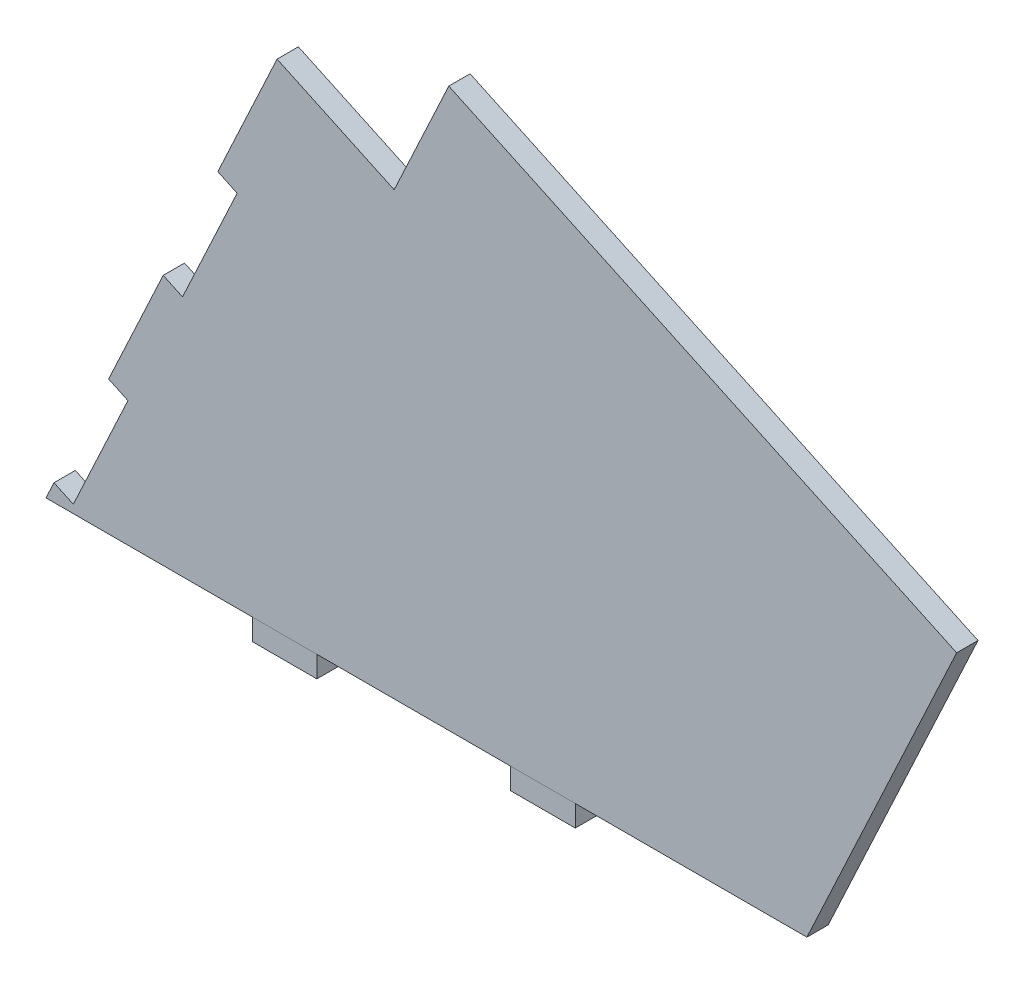
from build123d import *

# Parameters (mm, degrees)
BOSS_EXTRUDE1_DEPTH   = 3.3
CUT_EXTRUDE1_DEPTH    = 3.3
SKETCH3_W             = 10
SKETCH3_H             = 3.3
BOSS_EXTRUDE2_DEPTH   = 3.3
BOSS_EXTRUDE2_2_DEPTH = 3.3


with BuildPart() as part:
    # Sketch1 → Boss-Extrude1 (new body)
    with BuildSketch(Plane.XY.offset(396.7)):
        Polygon((-321.546211223, 12.634626083), (-203.763939035, 12.634626089), (-180.579435925, 62.353953457), (-259.198908878, 99.014815774), (-267.651274112, 80.888660034), (-285.777429853, 89.341025269), align=None)
    extrude(amount=-BOSS_EXTRUDE1_DEPTH)

    # Sketch2 → Cut-Extrude1 (cut)
    with BuildSketch(Plane.XY.offset(396.7)):
        Polygon((-311.856397536, 33.414498593), (-320.308762771, 15.288342852), (-317.317947074, 13.893702588), (-308.865581839, 32.019858329), align=None)
        Polygon((-303.404032301, 51.540654333), (-294.951667066, 69.666810074), (-291.960851369, 68.27216981), (-300.413216604, 50.14601407), align=None)
    extrude(amount=-CUT_EXTRUDE1_DEPTH, mode=Mode.SUBTRACT)


with BuildPart() as body_2:
    # Sketch3 → Boss-Extrude2 (new body)
    with BuildSketch(Plane.XY.offset(396.7)):
        with Locations((-244.617848709, 10.984626083)):
            Rectangle(SKETCH3_W, SKETCH3_H)
    extrude(amount=-BOSS_EXTRUDE2_DEPTH)


with BuildPart() as body_3:
    # Sketch3 → Boss-Extrude2 2 (new body)
    with BuildSketch(Plane.XY.offset(396.7)):
        with Locations((-284.617848709, 10.984626083)):
            Rectangle(SKETCH3_W, SKETCH3_H)
    extrude(amount=-BOSS_EXTRUDE2_2_DEPTH)


solid = Compound([part.part, body_2.part, body_3.part])
